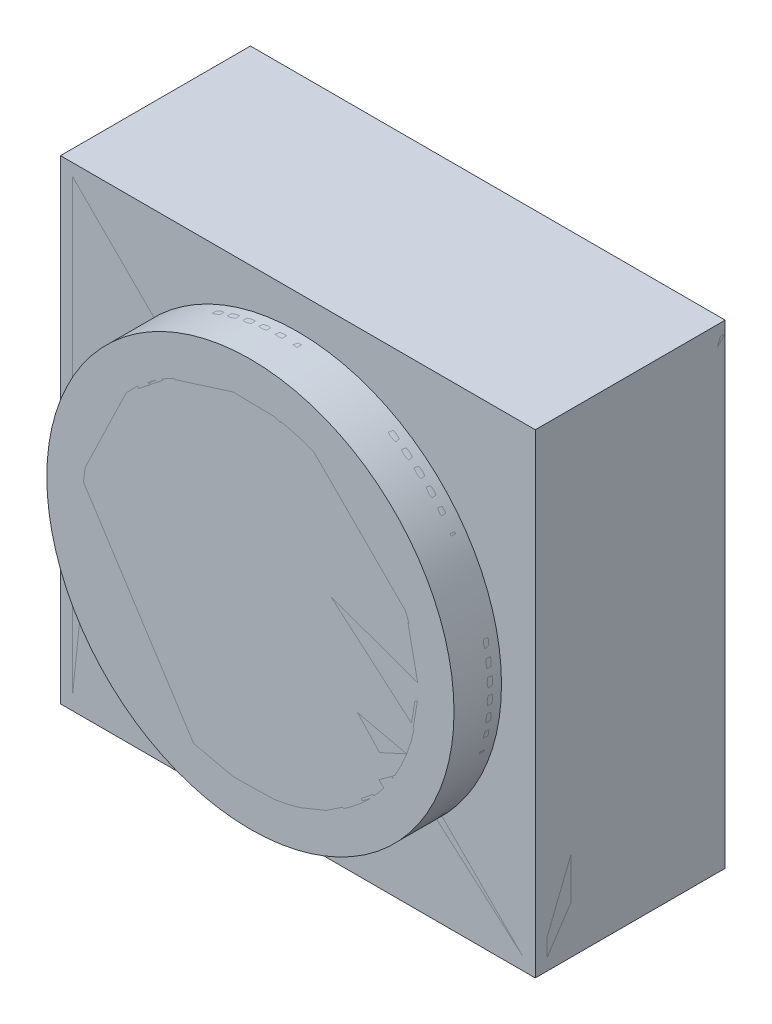
from build123d import *

# Parameters (mm, degrees)
SCHIZZO2_W                            = 200
SCHIZZO2_H                            = 200
ESTRUSIONE_ESTRUSIONE1_DEPTH          = 80
CORPO_SPOSTA_COPIA1_START             = -200
CORPO_SPOSTA_COPIA1_OUTLINE_W         = 200
CORPO_SPOSTA_COPIA1_OUTLINE_H         = 80
CORPO_SPOSTA_COPIA1_DEPTH             = 200
SCHIZZO5_W                            = 50
SCHIZZO5_H                            = 160
TAGLIO_ESTRUSIONE1_DEPTH              = 5
TAGLIO_ESTRUSIONE1_DRAFT              = -45
RIPETIZIONECIRCOLARE2_COPY_1_SKETCH_W = 50
RIPETIZIONECIRCOLARE2_COPY_1_SKETCH_H = 160
RIPETIZIONECIRCOLARE2_COPY_1_DEPTH    = 5
RIPETIZIONECIRCOLARE2_COPY_1_DRAFT    = -45
RIPETIZIONECIRCOLARE2_COPY_2_SKETCH_W = 50
RIPETIZIONECIRCOLARE2_COPY_2_SKETCH_H = 160
RIPETIZIONECIRCOLARE2_COPY_2_DEPTH    = 5
RIPETIZIONECIRCOLARE2_COPY_2_DRAFT    = -45
RIPETIZIONECIRCOLARE2_COPY_3_SKETCH_W = 50
RIPETIZIONECIRCOLARE2_COPY_3_SKETCH_H = 160
RIPETIZIONECIRCOLARE2_COPY_3_DEPTH    = 5
RIPETIZIONECIRCOLARE2_COPY_3_DRAFT    = -45
SMUSSO1_SIZE                          = 5
SCHIZZO7_R                            = 85.767086788
ESTRUSIONE_ESTRUSIONE2_DEPTH          = 20


# Read off the part's stored shape, not the designer's step: Corpo-Sposta/copia1
with BuildPart() as part:
    # Schizzo2 → Estrusione-Estrusione1 (new body)
    with BuildSketch(Plane.XY):
        with Locations((-100, -43.781574918)):
            Rectangle(SCHIZZO2_W, SCHIZZO2_H)
    extrude(amount=ESTRUSIONE_ESTRUSIONE1_DEPTH)

    # Schizzo4 → Rivoluzione3 (revolve)
    with BuildSketch(Plane(origin=(0, -43.781574918, 0), x_dir=(-1, 0, 0), z_dir=(0, 1, 0)), mode=Mode.PRIVATE) as rivoluzione3_sk:
        with BuildLine():
            Line((100, 100), (29.460733668, 100))
            ThreePointArc((29.460733668, 100), (17.120628135, 93.694528522), (15, 80))
            Line((15, 80), (100, 80))
            Line((100, 80), (100, 100))
        make_face()
    revolve(rivoluzione3_sk.sketch.rotate(Axis((-100, -43.781574918, 80), (0, 0, 1)), 180), axis=Axis((-100, -43.781574918, 80), (0, 0, 1)))


with BuildPart() as body_2:
    # Corpo-Sposta/copia1 outline → Corpo-Sposta/copia1 (new body)
    with BuildSketch(Plane.YZ.offset(CORPO_SPOSTA_COPIA1_START)):
        with Locations((-43.781574918, 40)):
            Rectangle(CORPO_SPOSTA_COPIA1_OUTLINE_W, CORPO_SPOSTA_COPIA1_OUTLINE_H)
    extrude(amount=CORPO_SPOSTA_COPIA1_DEPTH)


with BuildPart() as taglio_estrusione1_tool:
    # Schizzo5 → Taglio-Estrusione1 (with draft: the straight prism first)
    with BuildSketch(Plane(origin=(0, 0, 0), x_dir=(0, 0, -1), z_dir=(1, 0, 0))):
        with Locations((-40, -43.781574918)):
            Rectangle(SCHIZZO5_W, SCHIZZO5_H)
    extrude(amount=-TAGLIO_ESTRUSIONE1_DEPTH)
    # Taglio-Estrusione1: the draft: its side faces are tilted about the plane it starts from
    taglio_estrusione1_sides = [taglio_estrusione1_tool.faces().sort_by_distance(p)[0] for p in [
        (-2.5, -123.781574918, 40),
        (-2.5, -43.781574918, 15),
        (-2.5, 36.218425082, 40),
        (-2.5, -43.781574918, 65),
    ]]
    draft(taglio_estrusione1_sides, Plane(origin=(0, 0, 0), x_dir=(0, 0, -1), z_dir=(1, 0, 0)), TAGLIO_ESTRUSIONE1_DRAFT)


with BuildPart() as part_1:
    add(part.part)

    # Taglio-Estrusione1: cut by taglio_estrusione1_tool
    add(taglio_estrusione1_tool.part, mode=Mode.SUBTRACT)


with BuildPart() as ripetizionecircolare2_copy_1_tool:
    # RipetizioneCircolare2 copy 1 sketch → RipetizioneCircolare2 copy 1 (with draft: the straight prism first)
    with BuildSketch(Plane(origin=(-143.781574918, 56.218425082, 0), x_dir=(0, 0, -1), z_dir=(0, 1, 0))):
        with Locations((-40, -43.781574918)):
            Rectangle(RIPETIZIONECIRCOLARE2_COPY_1_SKETCH_W, RIPETIZIONECIRCOLARE2_COPY_1_SKETCH_H)
    extrude(amount=-RIPETIZIONECIRCOLARE2_COPY_1_DEPTH)
    # RipetizioneCircolare2 copy 1: the draft: its side faces are tilted about the plane it starts from
    ripetizionecircolare2_copy_1_sides = [ripetizionecircolare2_copy_1_tool.faces().sort_by_distance(p)[0] for p in [
        (-20, 53.718425082, 40),
        (-100, 53.718425082, 15),
        (-180, 53.718425082, 40),
        (-100, 53.718425082, 65),
    ]]
    draft(ripetizionecircolare2_copy_1_sides, Plane(origin=(-143.781574918, 56.218425082, 0), x_dir=(0, 0, -1), z_dir=(0, 1, 0)), RIPETIZIONECIRCOLARE2_COPY_1_DRAFT)


with BuildPart() as part_2:
    add(part_1.part)

    # RipetizioneCircolare2 copy 1: cut by ripetizionecircolare2_copy_1_tool
    add(ripetizionecircolare2_copy_1_tool.part, mode=Mode.SUBTRACT)


with BuildPart() as ripetizionecircolare2_copy_2_tool:
    # RipetizioneCircolare2 copy 2 sketch → RipetizioneCircolare2 copy 2 (with draft: the straight prism first)
    with BuildSketch(Plane(origin=(-200, -87.563149837, 0), x_dir=(0, 0, -1), z_dir=(-1, 0, 0))):
        with Locations((-40, -43.781574918)):
            Rectangle(RIPETIZIONECIRCOLARE2_COPY_2_SKETCH_W, RIPETIZIONECIRCOLARE2_COPY_2_SKETCH_H)
    extrude(amount=-RIPETIZIONECIRCOLARE2_COPY_2_DEPTH)
    # RipetizioneCircolare2 copy 2: the draft: its side faces are tilted about the plane it starts from
    ripetizionecircolare2_copy_2_sides = [ripetizionecircolare2_copy_2_tool.faces().sort_by_distance(p)[0] for p in [
        (-197.5, 36.218425081, 40),
        (-197.5, -43.781574919, 15),
        (-197.5, -123.781574919, 40),
        (-197.5, -43.781574919, 65),
    ]]
    draft(ripetizionecircolare2_copy_2_sides, Plane(origin=(-200, -87.563149837, 0), x_dir=(0, 0, -1), z_dir=(-1, 0, 0)), RIPETIZIONECIRCOLARE2_COPY_2_DRAFT)


with BuildPart() as part_3:
    add(part_2.part)

    # RipetizioneCircolare2 copy 2: cut by ripetizionecircolare2_copy_2_tool
    add(ripetizionecircolare2_copy_2_tool.part, mode=Mode.SUBTRACT)


with BuildPart() as ripetizionecircolare2_copy_3_tool:
    # RipetizioneCircolare2 copy 3 sketch → RipetizioneCircolare2 copy 3 (with draft: the straight prism first)
    with BuildSketch(Plane(origin=(-56.218425082, -143.781574918, 0), x_dir=(0, 0, -1), z_dir=(0, -1, 0))):
        with Locations((-40, -43.781574918)):
            Rectangle(RIPETIZIONECIRCOLARE2_COPY_3_SKETCH_W, RIPETIZIONECIRCOLARE2_COPY_3_SKETCH_H)
    extrude(amount=-RIPETIZIONECIRCOLARE2_COPY_3_DEPTH)
    # RipetizioneCircolare2 copy 3: the draft: its side faces are tilted about the plane it starts from
    ripetizionecircolare2_copy_3_sides = [ripetizionecircolare2_copy_3_tool.faces().sort_by_distance(p)[0] for p in [
        (-180, -141.281574918, 40),
        (-100, -141.281574918, 15),
        (-20, -141.281574918, 40),
        (-100, -141.281574918, 65),
    ]]
    draft(ripetizionecircolare2_copy_3_sides, Plane(origin=(-56.218425082, -143.781574918, 0), x_dir=(0, 0, -1), z_dir=(0, -1, 0)), RIPETIZIONECIRCOLARE2_COPY_3_DRAFT)


with BuildPart() as part_4:
    add(part_3.part)

    # RipetizioneCircolare2 copy 3: cut by ripetizionecircolare2_copy_3_tool
    add(ripetizionecircolare2_copy_3_tool.part, mode=Mode.SUBTRACT)

    # Smusso1
    smusso1_edges = [part_4.edges().sort_by_distance(p)[0] for p in [
        (-200, -43.781574918, 80),
        (-100, -143.781574918, 80),
        (0, -43.781574918, 80),
        (-100, 56.218425082, 80),
        (0, -143.781574918, 40),
        (-200, -143.781574918, 40),
        (-200, 56.218425082, 40),
        (0, 56.218425082, 40),
    ]]
    chamfer(smusso1_edges, length=SMUSSO1_SIZE)


with BuildPart() as body_3:
    # Schizzo7 → Estrusione-Estrusione2 (new body)
    with BuildSketch(Plane.XY.offset(80)):
        with Locations((-100, -43.781574918)):
            Circle(SCHIZZO7_R)
    extrude(amount=ESTRUSIONE_ESTRUSIONE2_DEPTH)


solid = Compound([body_2.part, part_4.part, body_3.part])
